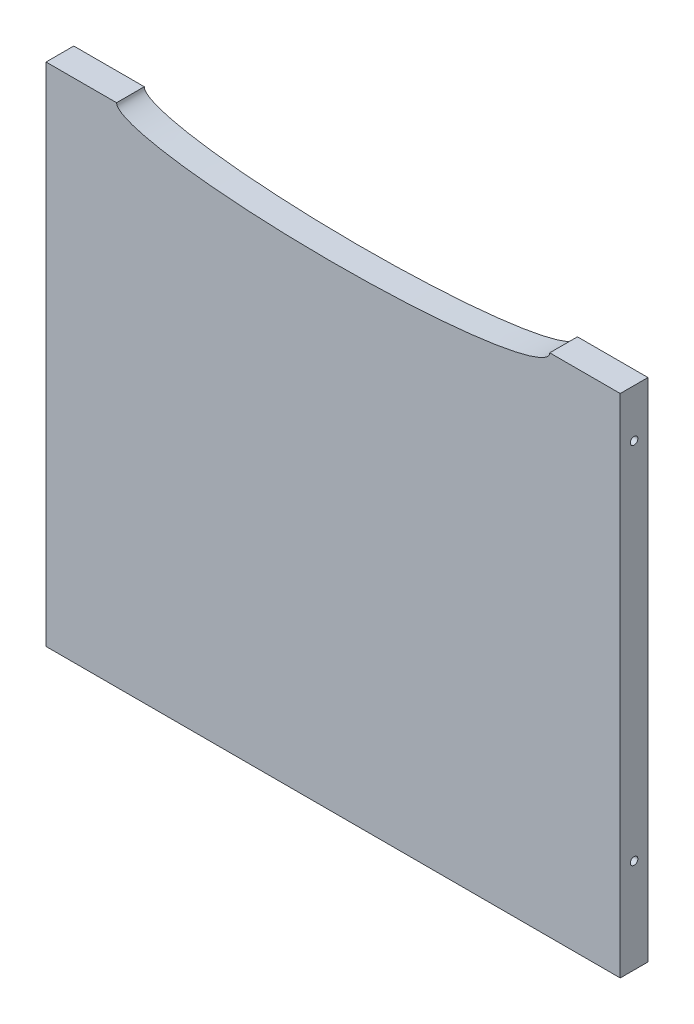
from build123d import *

# Parameters (mm, degrees)
BOSS_EXTRUDE1_DEPTH = 17.4625
RIGHTSCREWHOLES_R   = 2.38125
CUT_EXTRUDE1_DEPTH  = 50.8
CUT_EXTRUDE2_START  = -50.8
LEFTSCREWHOLES_R    = 2.38125
CUT_EXTRUDE2_DEPTH  = 50.8
BOTTOMSCREWHOLES_R  = 2.38125
CUT_EXTRUDE3_DEPTH  = 50.8


with BuildPart() as part:
    # PanelSketch → Boss-Extrude1 (new body)
    with BuildSketch(Plane.XY):
        with BuildLine():
            Line((-180.975, 159.54375), (-180.975, -159.54375))
            Line((-180.975, -159.54375), (180.975, -159.54375))
            Line((180.975, -159.54375), (180.975, 159.54375))
            Line((180.975, 159.54375), (136.525, 159.54375))
            add(Edge.make_bspline(
                [(-136.525, 159.54375), (-136.525, 140.49375), (0, 140.49375), (136.525, 140.49375), (136.525, 159.54375)],
                knots=[3.141592654, 3.141592654, 3.141592654, 4.71238898, 4.71238898, 6.283185307, 6.283185307, 6.283185307], degree=2, weights=[1, 0.707106781, 1, 0.707106781, 1]))
            Line((-136.525, 159.54375), (-180.975, 159.54375))
        make_face()
    extrude(amount=BOSS_EXTRUDE1_DEPTH)

    # RightScrewHoles → Cut-Extrude1 (cut)
    with BuildSketch(Plane(origin=(180.975, 0, 0), x_dir=(0, 0, -1), z_dir=(1, 0, 0))):
        with Locations((-8.73125, 129.38125)):
            Circle(RIGHTSCREWHOLES_R)
        with Locations((-8.73125, -100.0125)):
            Circle(RIGHTSCREWHOLES_R)
    extrude(amount=-CUT_EXTRUDE1_DEPTH, mode=Mode.SUBTRACT)

    # LeftScrewHoles → Cut-Extrude2 (cut)
    with BuildSketch(Plane.ZY.offset(180.975).offset(CUT_EXTRUDE2_START)):
        with Locations((8.73125, 129.38125)):
            Circle(LEFTSCREWHOLES_R)
        with Locations((8.73125, -100.0125)):
            Circle(LEFTSCREWHOLES_R)
    extrude(amount=CUT_EXTRUDE2_DEPTH, mode=Mode.SUBTRACT)

    # BottomScrewHoles → Cut-Extrude3 (cut)
    with BuildSketch(Plane.XZ.offset(159.54375)):
        with Locations((-111.125, 8.73125)):
            Circle(BOTTOMSCREWHOLES_R)
        with Locations((111.125, 8.73125)):
            Circle(BOTTOMSCREWHOLES_R)
    extrude(amount=-CUT_EXTRUDE3_DEPTH, mode=Mode.SUBTRACT)


solid = part.part
